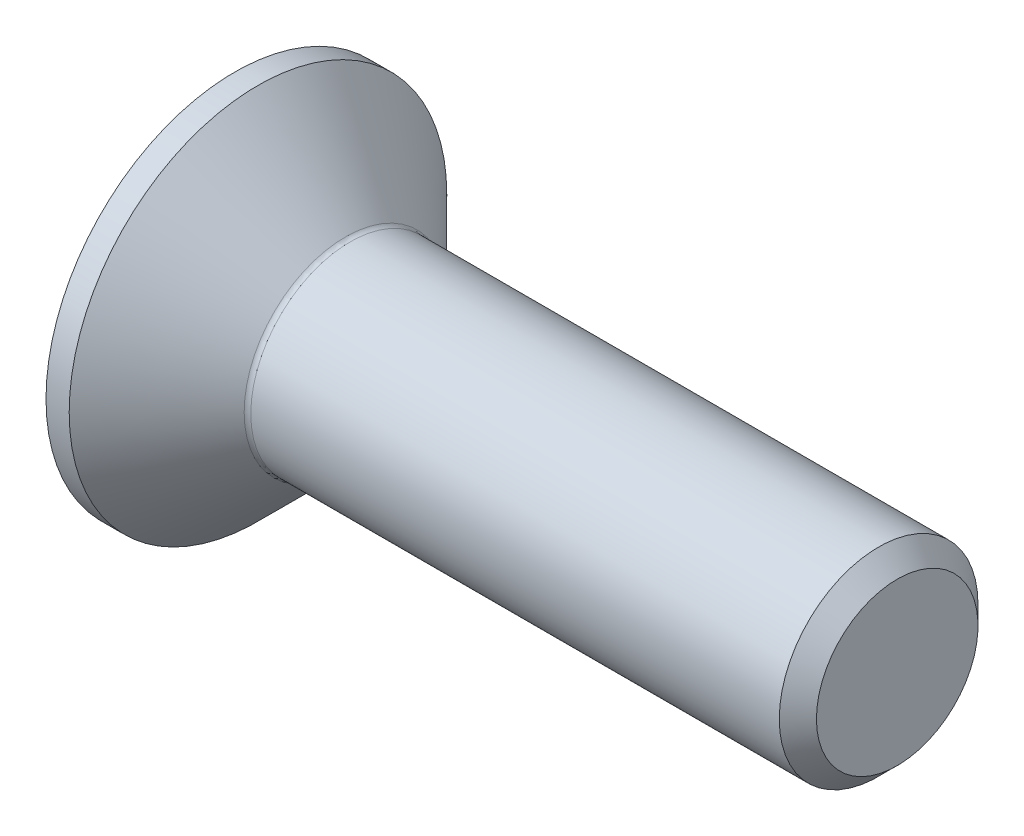
from build123d import *

# Parameters (mm, degrees)
FILLET1_R   = 0.1
HEX_START   = -1.2
HEX_2_DEPTH = 1.2


with BuildPart() as part:
    # BodySke → BaseBody (revolve)
    with BuildSketch(Plane.XY, mode=Mode.PRIVATE) as basebody_sk:
        Polygon((0, 0), (0, 2.85), (0.35, 2.85), (1.7, 1.5), (9.7195, 1.5), (10, 1.2195), (10, 0), align=None)
    revolve(basebody_sk.sketch.rotate(Axis((0, 0, 0), (1, 0, 0)), 90), axis=Axis((0, 0, 0), (1, 0, 0)))

    # Fillet1
    fillet1_edges = [part.edges().sort_by_distance(p)[0] for p in [
        (1.7, 0, -1.5),
    ]]
    fillet(fillet1_edges, radius=FILLET1_R)

    # Hex 2: read off the stored shape, not the designer's step
    # Hex 2 outline → Hex 2 (cut)
    with BuildSketch(Plane.ZY.offset(HEX_START)):
        Polygon((-1.01, -0.583123772), (0, -1.166247544), (1.01, -0.583123772), (1.01, 0.583123772), (0, 1.166247544), (-1.01, 0.583123772), align=None)
    extrude(amount=HEX_2_DEPTH, mode=Mode.SUBTRACT)

    # Hex 2 2 outline → Hex 2 2 (revolve, cut)
    with BuildSketch(Plane.YX):
        Polygon((1.01, 1.2), (0, 1.783123772), (0, 1.2), align=None)
    revolve(axis=Axis((0, 0, 0), (1, 0, 0)), mode=Mode.SUBTRACT)


solid = part.part
